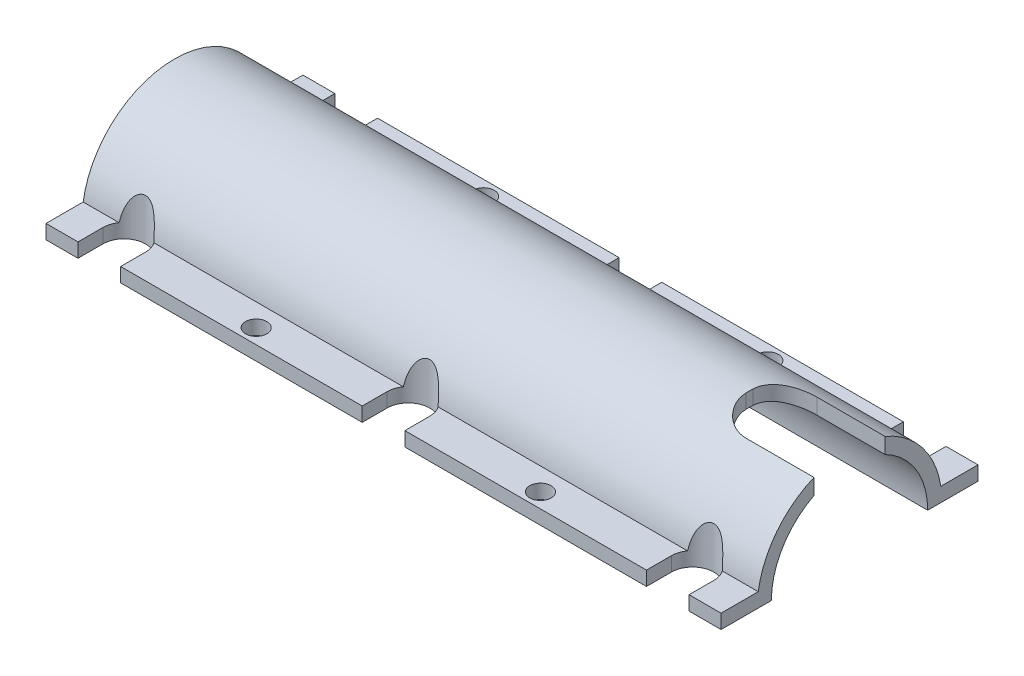
from build123d import *

# Parameters (mm, degrees)
EXTRUDE_1_DEPTH          = 95
CUT_EXTRUDE_1_DEPTH      = 98.328840189
CUT_EXTRUDE_1_DEPTH_BACK = 98.328840189
SKETCH_2_R               = 1.5
CUT_EXTRUDE_2_DEPTH      = 98.575312762


with BuildPart() as part:
    # Эскиз1 → Бобышка-Вытянуть1 (new body)
    with BuildSketch(Plane(origin=(0, 0, 0), x_dir=(0, 0, -1), z_dir=(1, 0, 0))):
        with BuildLine():
            Line((11, 0), (18.079487192, 0))
            Line((18.079487192, 0), (18.079487192, 2))
            Line((18.079487192, 2), (12.848104212, 2))
            ThreePointArc((12.848104212, 2), (0.000220895, 13.002837452), (-12.848036252, 2.000436531))
            Line((-12.848036252, 2.000436531), (-18.079487192, 2))
            Line((-18.079487192, 2), (-18.079487192, 0))
            Line((-18.079487192, 0), (-11, 0))
            ThreePointArc((-11, 0), (0, 11), (11, 0))
        make_face()
    extrude(amount=EXTRUDE_1_DEPTH)

    # Эскиз2 → Вырез-Вытянуть1 (cut, two sides: drawn at the far end of the back side and taken through both)
    with BuildSketch(Plane(origin=(0, 2.001508604, 0.000167013), x_dir=(1, 0, 0), z_dir=(0, 0.9999999965185793, 8.344364312112643e-05)).offset(-CUT_EXTRUDE_1_DEPTH_BACK)):
        with Locations((27.5, -16)):
            Circle(SKETCH_2_R)
        with Locations((67.5, -16)):
            Circle(SKETCH_2_R)
        with Locations((67.5, 16)):
            Circle(SKETCH_2_R)
        with Locations((27.5, 16)):
            Circle(SKETCH_2_R)
        with BuildLine():
            Line((4.5, -14.579320241), (4.5, -18.29882224))
            Line((4.5, -18.29882224), (10.5, -18.29882224))
            Line((10.5, -18.29882224), (10.5, -14.579320241))
            ThreePointArc((10.5, -14.579320241), (7.5, -11.579320241), (4.5, -14.579320241))
        make_face()
        with BuildLine():
            Line((50.5, -18.29882224), (50.5, -14.579320241))
            ThreePointArc((50.5, -14.579320241), (47.5, -11.579320241), (44.5, -14.579320241))
            Line((44.5, -14.579320241), (44.5, -18.29882224))
            Line((44.5, -18.29882224), (50.5, -18.29882224))
        make_face()
        with BuildLine():
            Line((90.5, -18.29882224), (90.5, -14.579320241))
            ThreePointArc((90.5, -14.579320241), (87.5, -11.579320241), (84.5, -14.579320241))
            Line((84.5, -14.579320241), (84.5, -18.29882224))
            Line((84.5, -18.29882224), (90.5, -18.29882224))
        make_face()
        with BuildLine():
            Line((84.5, 18.29882224), (90.5, 18.29882224))
            Line((90.5, 18.29882224), (90.5, 14.579320241))
            ThreePointArc((90.5, 14.579320241), (87.5, 11.579320241), (84.5, 14.579320241))
            Line((84.5, 14.579320241), (84.5, 18.29882224))
        make_face()
        with BuildLine():
            Line((44.5, 18.29882224), (50.5, 18.29882224))
            Line((50.5, 18.29882224), (50.5, 14.579320241))
            ThreePointArc((50.5, 14.579320241), (47.5, 11.579320241), (44.5, 14.579320241))
            Line((44.5, 14.579320241), (44.5, 18.29882224))
        make_face()
        with BuildLine():
            Line((4.5, 18.29882224), (10.5, 18.29882224))
            Line((10.5, 18.29882224), (10.5, 14.579320241))
            ThreePointArc((10.5, 14.579320241), (7.5, 11.579320241), (4.5, 14.579320241))
            Line((4.5, 14.579320241), (4.5, 18.29882224))
        make_face()
    extrude(amount=CUT_EXTRUDE_1_DEPTH + CUT_EXTRUDE_1_DEPTH_BACK, mode=Mode.SUBTRACT)

    # Эскиз3 → Вырез-Вытянуть2 (cut, through all)
    with BuildSketch(Plane.XZ):
        with BuildLine():
            Line((85.409616901, 5), (95, 5))
            Line((95, 5), (95, -5))
            Line((95, -5), (85.409616901, -5))
            ThreePointArc((85.409616901, -5), (82.227636386, -3.681980515), (80.909616901, -0.5))
            Line((80.909616901, -0.5), (80.909616901, 0.5))
            ThreePointArc((80.909616901, 0.5), (82.227636386, 3.681980515), (85.409616901, 5))
        make_face()
    extrude(amount=-CUT_EXTRUDE_2_DEPTH, mode=Mode.SUBTRACT)


solid = part.part
